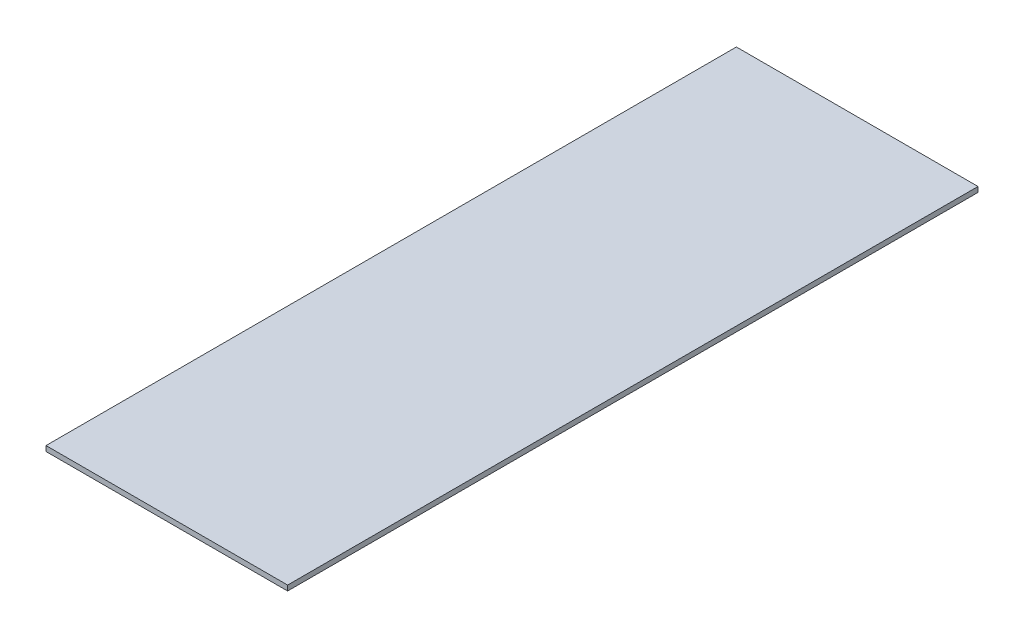
from build123d import *

# Parameters (mm, degrees)
SKETCH2_W           = 140
SKETCH2_H           = 400
BOSS_EXTRUDE1_DEPTH = 3


with BuildPart() as part:
    # Sketch2 → Boss-Extrude1 (new body)
    with BuildSketch(Plane(origin=(0, 0, 0), x_dir=(1, 0, 0), z_dir=(0, 1, 0))):
        with Locations((70, 200)):
            Rectangle(SKETCH2_W, SKETCH2_H)
    extrude(amount=BOSS_EXTRUDE1_DEPTH)


solid = part.part
